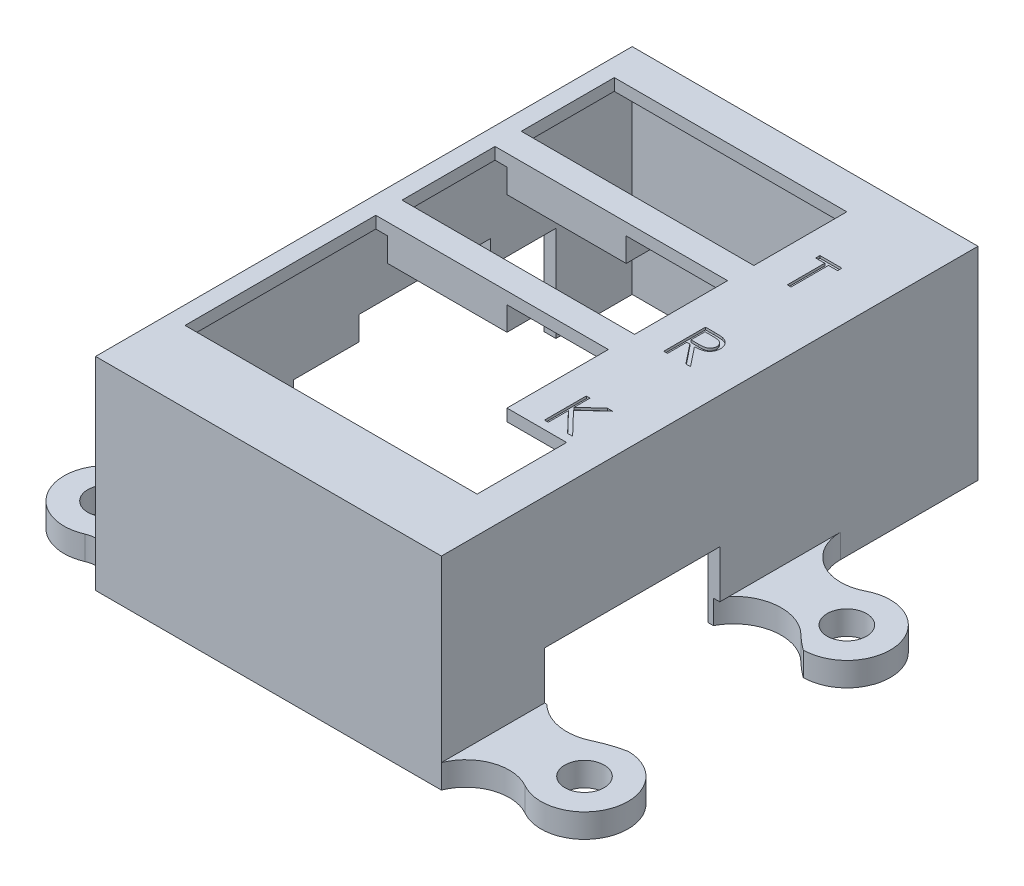
from build123d import *

# Parameters (mm, degrees)
SKETCH1_W           = 29
SKETCH1_H           = 45
BOSS_EXTRUDE1_DEPTH = 15
SHELL2_T            = -1
SKETCH2_W           = 19.5
SKETCH2_H           = 7.8
CUT_EXTRUDE2_DEPTH  = 31.683871985
SKETCH3_W           = 10
SKETCH3_H           = 2.2
BOSS_EXTRUDE2_DEPTH = 2
CUTOUT_W            = 11
CUTOUT_H            = 2
CUT_EXTRUDE3_DEPTH  = 1
SKETCH5_R           = 1.65
BOSS_EXTRUDE3_DEPTH = 2
CUT_EXTRUDE4_DEPTH  = 0.2
CUT_EXTRUDE5_REACH  = 47.546
SKETCH7_W           = 14.7
SKETCH7_H           = 4
CUT_EXTRUDE6_DEPTH  = 10
FILLET1_R           = 10


with BuildPart() as part:
    # Sketch1 → Boss-Extrude1 (new body)
    with BuildSketch(Plane(origin=(0, 0, 0), x_dir=(1, 0, 0), z_dir=(0, 1, 0))):
        Rectangle(SKETCH1_W, SKETCH1_H)
    extrude(amount=BOSS_EXTRUDE1_DEPTH)

    # Shell2
    shell2_openings = [part.faces().sort_by_distance(p)[0] for p in [
        (0, 0, 0),
    ]]
    offset(amount=SHELL2_T, openings=shell2_openings, kind=Kind.INTERSECTION)

    # Sketch2 → Cut-Extrude2 (cut, through all)
    with BuildSketch(Plane(origin=(0, 15, 0), x_dir=(1, 0, 0), z_dir=(0, 1, 0))):
        with Locations((-3.25, 5.6)):
            Rectangle(SKETCH2_W, SKETCH2_H)
        with Locations((-3.25, 15.6)):
            Rectangle(SKETCH2_W, SKETCH2_H)
        Polygon((-13, -0.5), (-13, -8.3), (-13, -9.7), (-13, -16.5), (11.5, -16.5), (11.5, -9), (6.5, -9), (6.5, -8.3), (6.5, -0.5), align=None)
    extrude(amount=-CUT_EXTRUDE2_DEPTH, mode=Mode.SUBTRACT)

    # Sketch3 → Boss-Extrude2 (add)
    with BuildSketch(Plane.XZ.offset(-14)):
        with Locations((-7, -0.6)):
            Rectangle(SKETCH3_W, SKETCH3_H)
        with Locations((-7, -10.6)):
            Rectangle(SKETCH3_W, SKETCH3_H)
    extrude(amount=BOSS_EXTRUDE2_DEPTH)

    # cutout → Cut-Extrude3 (cut)
    with BuildSketch(Plane.ZY.offset(14.5)):
        with Locations((-4.1, 7)):
            Rectangle(CUTOUT_W, CUTOUT_H)
        Polygon((-9.6, 6), (-15.1, 6), (-15.1, 0), (6.9, 0), (6.9, 6), (1.4, 6), align=None)
    extrude(amount=-CUT_EXTRUDE3_DEPTH, mode=Mode.SUBTRACT)

    # Sketch5 → Boss-Extrude3 (add)
    # profile 1 of 2: a face of its own
    with BuildSketch(Plane.XZ):
        with BuildLine():
            Line((-14.5, 10.208395238), (-14.5, 6.9))
            Line((-14.5, 6.9), (-13.5, 6.9))
            Line((-13.5, 6.9), (-13.5, 21.5))
            Line((-13.5, 21.5), (13.5, 21.5))
            Line((13.5, 21.5), (13.5, 13.85))
            Line((13.5, 13.85), (21.5, 13.85))
            ThreePointArc((21.5, 13.85), (25.028786021, 18.432828613), (19.696299962, 20.673194947))
            ThreePointArc((19.696299962, 20.673194947), (16.682040183, 20.402983861), (14.5, 22.5))
            Line((14.5, 22.5), (-14.5, 22.5))
            ThreePointArc((-14.5, 22.5), (-15.319286654, 20.985758581), (-17.035039959, 20.843111138))
            ThreePointArc((-17.035039959, 20.843111138), (-22.089372546, 18.162498848), (-18.325, 13.854197619))
            ThreePointArc((-18.325, 13.854197619), (-15.631692036, 12.850482481), (-14.5, 10.208395238))
        make_face()
        with Locations(Location((-18.5, 17.5, 0), (0, 0, 270))):
            Circle(SKETCH5_R, mode=Mode.SUBTRACT)
        with Locations(Location((21.5, 17.5, 0), (0, 0, 270))):
            Circle(SKETCH5_R, mode=Mode.SUBTRACT)
    # profile 2 of 2: a face of its own
    with BuildSketch(Plane.XZ):
        with BuildLine():
            Line((14.5, -22.5), (14.5, -10.985946346))
            ThreePointArc((14.5, -10.985946346), (16.25148084, -7.86855561), (19.825, -7.742973173))
            ThreePointArc((19.825, -7.742973173), (25.046783901, -5.361872357), (21.5, -0.85))
            Line((21.5, -0.85), (13.5, -0.85))
            Line((13.5, -0.85), (13.5, -21.5))
            Line((13.5, -21.5), (-13.5, -21.5))
            Line((-13.5, -21.5), (-13.5, -15.1))
            Line((-13.5, -15.1), (-14.5, -15.1))
            Line((-14.5, -15.1), (-14.5, -22.5))
            Line((-14.5, -22.5), (14.5, -22.5))
        make_face()
        with Locations(Location((21.5, -4.5, 0), (0, 0, 270))):
            Circle(SKETCH5_R, mode=Mode.SUBTRACT)
    extrude(amount=BOSS_EXTRUDE3_DEPTH)

    # Sketch6 → Cut-Extrude4 (cut)
    # profile 1 of 3: a face of its own
    with BuildSketch(Plane(origin=(0, 15, 0), x_dir=(1, 0, 0), z_dir=(0, 1, 0))):
        Polygon((8.544871795, 14.841025641), (8.544871795, 15.2), (10.384615385, 15.2), (10.384615385, 14.841025641), (9.621794872, 14.841025641), (9.621794872, 11.7), (9.307692308, 11.7), (9.307692308, 14.841025641), align=None)
    # profile 2 of 3: a face of its own
    with BuildSketch(Plane(origin=(0, 15, 0), x_dir=(1, 0, 0), z_dir=(0, 1, 0))):
        with BuildLine():
            Line((8.948717949, 5.2), (9.649138622, 5.2))
            add(Edge.make_bspline(
                [(9.649138622, 5.2), (9.69587975, 5.199844414), (9.785627895, 5.199545672), (9.914201165, 5.197879909), (10.031028262, 5.193105553), (10.136048101, 5.18899697), (10.229258756, 5.181505028), (10.310946047, 5.174344381), (10.380733745, 5.16497072), (10.422979596, 5.156265297), (10.442107372, 5.152323718)],
                knots=[0, 0, 0, 0, 1.410062039, 2.707475311, 3.878576406, 4.937260626, 5.877586885, 6.699081471, 7.410979367, 8, 8, 8, 8], degree=3))
            add(Edge.make_bspline(
                [(10.442107372, 5.152323718), (10.467713996, 5.145996953), (10.518380985, 5.133478389), (10.591331051, 5.107018788), (10.660845375, 5.076399163), (10.7266352, 5.040435443), (10.788370991, 4.998860663), (10.846689302, 4.952392541), (10.901854765, 4.901285335), (10.951636395, 4.844250494), (10.998575447, 4.784413984), (11.038164073, 4.719710227), (11.072290553, 4.6520487), (11.09946107, 4.580741282), (11.121339044, 4.50647951), (11.136765283, 4.428590713), (11.146016471, 4.347429738), (11.146958326, 4.29207183), (11.147435897, 4.264002404)],
                knots=[0, 0, 0, 0, 1.027469482, 2.033020251, 3.019912614, 3.986113645, 4.951240523, 5.91722682, 6.890402269, 7.87763091, 8.8651537, 9.85103654, 10.82876324, 11.815024772, 12.821070561, 13.842952187, 14.906261191, 16, 16, 16, 16], degree=3))
            add(Edge.make_bspline(
                [(11.147435897, 4.264002404), (11.145966899, 4.217367299), (11.143100504, 4.126370131), (11.1163754, 3.99430925), (11.07259888, 3.871119935), (11.012275591, 3.756957297), (10.935456115, 3.654046652), (10.843131324, 3.563656197), (10.735249713, 3.488016284), (10.634820397, 3.435563479), (10.546106197, 3.401970571), (10.473072884, 3.378334212), (10.393405907, 3.360072247), (10.307868572, 3.343712115), (10.216104917, 3.33136042), (10.118334877, 3.322313826), (10.014488726, 3.316659777), (9.943149656, 3.315817772), (9.906450321, 3.315384615)],
                knots=[0, 0, 0, 0, 1.260483769, 2.459530307, 3.627416485, 4.787058657, 5.939039949, 7.08810263, 8.267026773, 9.491475466, 10.141966685, 10.831826277, 11.566392101, 12.351337768, 13.187381173, 14.07005841, 15.007169909, 16, 16, 16, 16], degree=3))
            Line((9.906450321, 3.315384615), (11.192307692, 1.7))
            Line((11.192307692, 1.7), (10.803886218, 1.7))
            Line((10.803886218, 1.7), (9.518028846, 3.315384615))
            Line((9.518028846, 3.315384615), (9.262820513, 3.315384615))
            Line((9.262820513, 3.315384615), (9.262820513, 1.7))
            Line((9.262820513, 1.7), (8.948717949, 1.7))
            Line((8.948717949, 1.7), (8.948717949, 5.2))
        make_face()
        with BuildLine():
            Line((9.262820513, 4.841025641), (9.262820513, 3.674358974))
            Line((9.262820513, 3.674358974), (9.903645833, 3.669451122))
            add(Edge.make_bspline(
                [(9.903645833, 3.669451122), (9.933565872, 3.669437885), (9.991559429, 3.669412229), (10.075460094, 3.673406005), (10.153580206, 3.677949323), (10.225620958, 3.684898669), (10.291614533, 3.69385474), (10.351527947, 3.705057725), (10.405458998, 3.718109787), (10.468357537, 3.738311413), (10.538594068, 3.770317431), (10.614925528, 3.81688293), (10.679927866, 3.875452049), (10.734845728, 3.942425505), (10.77897516, 4.016061754), (10.810087214, 4.095478123), (10.829829656, 4.178669721), (10.832158202, 4.235847829), (10.833333333, 4.264703526)],
                knots=[0, 0, 0, 0, 1.146690395, 2.22261258, 3.21895312, 4.145990853, 4.996080663, 5.770904154, 6.481378293, 7.121626537, 8.300444488, 9.431385265, 10.535395872, 11.636531494, 12.74115979, 13.810798291, 14.895190096, 16, 16, 16, 16], degree=3))
            add(Edge.make_bspline(
                [(10.833333333, 4.264703526), (10.832131212, 4.292850099), (10.829749047, 4.348626338), (10.810300278, 4.430282248), (10.777410897, 4.507349198), (10.733088659, 4.579513683), (10.679089504, 4.645019419), (10.615771691, 4.701066572), (10.544866496, 4.747316037), (10.478595298, 4.776870418), (10.419361085, 4.794990271), (10.367931425, 4.807741435), (10.309819948, 4.817985904), (10.244744489, 4.826193964), (10.172982858, 4.833248909), (10.094172207, 4.838000687), (10.008835427, 4.840814551), (9.949688496, 4.84095364), (9.919070513, 4.841025641)],
                knots=[0, 0, 0, 0, 1.101028733, 2.181837193, 3.264309656, 4.369019818, 5.486613113, 6.575447106, 7.666700264, 8.788928104, 9.402425223, 10.0903467, 10.862060571, 11.710948788, 12.657782767, 13.684531032, 14.801375019, 16, 16, 16, 16], degree=3))
            Line((9.919070513, 4.841025641), (9.262820513, 4.841025641))
        make_face(mode=Mode.SUBTRACT)
    # profile 3 of 3: a face of its own
    with BuildSketch(Plane(origin=(0, 15, 0), x_dir=(1, 0, 0), z_dir=(0, 1, 0))):
        Polygon((8.948717949, -4.8), (9.262820513, -4.8), (9.262820513, -6.132832532), (10.721854968, -4.8), (11.169871795, -4.8), (9.450020032, -6.370512821), (11.304487179, -8.3), (10.885917468, -8.3), (9.262820513, -6.610997596), (9.262820513, -8.3), (8.948717949, -8.3), align=None)
    extrude(amount=-CUT_EXTRUDE4_DEPTH, mode=Mode.SUBTRACT)

    # Sketch7 → Cut-Extrude5 (cut, up to next)
    with BuildSketch(Plane(origin=(14.5, 0, 0), x_dir=(0, 0, -1), z_dir=(1, 0, 0)), mode=Mode.PRIVATE) as cut_extrude5_sk1:
        with Locations((-6.5, 2)):
            Rectangle(SKETCH7_W, SKETCH7_H)
    cut_extrude5_tool1 = extrude(cut_extrude5_sk1.sketch, amount=-CUT_EXTRUDE5_REACH, mode=Mode.PRIVATE) & part.part
    add(cut_extrude5_tool1.solids().sort_by_distance((14.5, 2, 6.5))[0], mode=Mode.SUBTRACT)

    # Sketch8 → Cut-Extrude6 (cut)
    with BuildSketch(Plane(origin=(0, 0, 0), x_dir=(1, 0, 0), z_dir=(0, 1, 0))):
        with BuildLine():
            ThreePointArc((14.69331156, -13.85), (17.5, -15), (20.30668844, -13.85))
            Line((20.30668844, -13.85), (14.69331156, -13.85))
        make_face()
        with BuildLine():
            Line((14.69331156, -13.85), (20.30668844, -13.85))
            ThreePointArc((20.30668844, -13.85), (21.189630995, -12.544869936), (21.5, -11))
            ThreePointArc((21.5, -11), (15.955130064, -7.310369005), (14.69331156, -13.85))
        make_face()
        with BuildLine():
            ThreePointArc((21.046477125, 0.85), (17.982663806, 2.970772677), (14.5, 1.645751311))
            Line((14.5, 1.645751311), (14.5, 0.85))
            Line((14.5, 0.85), (21.046477125, 0.85))
        make_face()
        with BuildLine():
            Line((14.5, 0.85), (14.5, 1.645751311))
            ThreePointArc((14.5, 1.645751311), (16.085786438, -4.741657387), (21.5, -1))
            ThreePointArc((21.5, -1), (21.384965154, -0.047610505), (21.046477125, 0.85))
            Line((21.046477125, 0.85), (14.5, 0.85))
        make_face()
    extrude(amount=-CUT_EXTRUDE6_DEPTH, mode=Mode.SUBTRACT)

    # Fillet1
    # the kernel refuses this fillet: 10 mm, written as the material it takes off along each edge
    with BuildSketch(Plane(origin=(21.046477125, -5.126143642, -0.85), x_dir=(-0.5954001389119016, 0, -0.8034293214612523), z_dir=(0, 1, 0))) as fillet1_piece_1:
        with BuildLine():
            CenterArc((2.813529277, -9.877084918), FILLET1_R, 98.992616394, 8.967548011)
            Line((-0.270027583, -0.364373576), (-0.33169872, -0.174119349))
            ThreePointArc((-0.33169872, -0.174119349), (-0.295699656, -0.06310676), (-0.160685864, 0.119080028))
            Line((-0.160685864, 0.119080028), (0.031261436, 0.197541698))
            ThreePointArc((0.031261436, 0.197541698), (0.625228728, 0.150833967), (1.21919602, 0.197541698))
            Line((1.21919602, 0.197541698), (1.250457457, 0))
        make_face()
    extrude(amount=8.252287283, mode=Mode.SUBTRACT)
    with BuildSketch(Plane(origin=(20.30668844, -5.329363755, 13.85), x_dir=(-0.8193644478649244, 0, 0.5732729730023975), z_dir=(0, 1, 0))) as fillet1_piece_2:
        with BuildLine():
            CenterArc((2.99642738, 9.860468257), FILLET1_R, 246.583108126, 13.834356768)
            Line((-0.977757067, 0.684093266), (-1.057240756, 0.500565766))
            ThreePointArc((-1.057240756, 0.500565766), (-0.603533128, 0.178173743), (-0.114654595, -0.16387289))
            Line((-0.114654595, -0.16387289), (0.033293638, -0.197209365))
            ThreePointArc((0.033293638, -0.197209365), (0.665872751, -0.144187303), (1.298451864, -0.197209365))
            Line((1.298451864, -0.197209365), (1.331745502, 0))
        make_face()
    extrude(amount=8.65872751, mode=Mode.SUBTRACT)


solid = part.part
